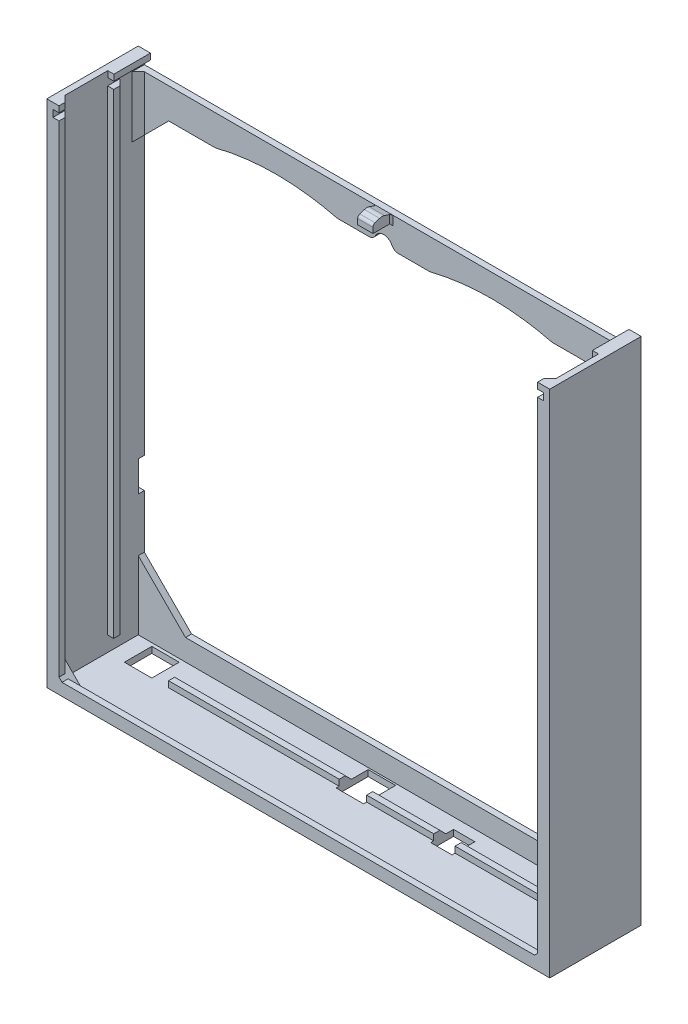
from build123d import *

# Parameters (mm, degrees)
BOSS_EXTRUDE1_DEPTH       = 35.56
BOSS_EXTRUDE2_DEPTH       = 2.54
BOSS_EXTRUDE3_REACH       = 236.724
BOSS_EXTRUDE4_REACH       = 236.724
BOSS_EXTRUDE5_DEPTH       = 2.54
BOSS_EXTRUDE6_DEPTH       = 204.47
BOSS_EXTRUDE7_REACH       = 236.724
BOSS_EXTRUDE8_DEPTH       = 2.54
BOSS_EXTRUDE9_DEPTH       = 2.54
SKETCH11_R                = 3.81
CUT_EXTRUDE1_DEPTH        = 2.54
FILLET1_R                 = 3.175
CHAMFER1_SIZE             = 2.54
SKETCH12_W                = 2.54
SKETCH12_H                = 38.1
BOSS_EXTRUDE10_DEPTH      = 5.461
SKETCH13_W                = 2.54
SKETCH13_H                = 2.54
BOSS_EXTRUDE11_DEPTH      = 38.1
BOSS_EXTRUDE12_DEPTH      = 3.175
BOSS_EXTRUDE12_DEPTH_BACK = 3.175
FILLET2_R                 = 3.175
CHAMFER2_SIZE             = 0.635
FILLET3_R                 = 1.27
CUT_EXTRUDE2_DEPTH        = 46.99
CUT_EXTRUDE2_DEPTH_BACK   = 3.175
SKETCH15_W                = 11.43
SKETCH15_H                = 11.43
SKETCH16_W                = 11.43
SKETCH16_H                = 37.106454998
SKETCH16_W_2              = 25.4
SKETCH16_H_2              = 12.337621438
CUT_EXTRUDE3_DEPTH        = 6.35
CUT_EXTRUDE4_DEPTH        = 2.54
SKETCH18_W                = 2.54
SKETCH18_H                = 12.7
CUT_EXTRUDE5_DEPTH        = 25.4
BOSS_EXTRUDE13_DEPTH      = 2.54
SKETCH20_W                = 8.89
SKETCH20_H                = 10.16
CUT_EXTRUDE6_DEPTH        = 2.54
SKETCH21_W                = 8.89
SKETCH21_H                = 9.525
CUT_EXTRUDE7_DEPTH        = 7.62


with BuildPart() as part:
    # Sketch1 → Boss-Extrude1 (new body)
    with BuildSketch(Plane.XY):
        Polygon((-102.235, 102.235), (-104.775, 102.235), (-104.775, -104.775), (104.775, -104.775), (104.775, 102.235), (102.235, 102.235), (102.235, -102.235), (-102.235, -102.235), align=None)
    extrude(amount=BOSS_EXTRUDE1_DEPTH)

    # Sketch2 → Boss-Extrude2 (add)
    with BuildSketch(Plane.XY.offset(35.56)):
        Polygon((-102.235, -102.235), (-102.235, -95.885), (-95.885, -102.235), align=None)
        Polygon((102.235, -102.235), (102.235, -95.885), (95.885, -102.235), align=None)
    extrude(amount=-BOSS_EXTRUDE2_DEPTH)

    # Boss-Extrude3: up to this face of the body (flat: up to its plane)
    boss_extrude3_end = Plane(part.part.faces().sort_by_distance((0, -102.235, 17.706426025))[0])
    # Sketch4 → Boss-Extrude3 (add, up to the picked face)
    with BuildSketch(Plane(origin=(0, 102.235, 0), x_dir=(1, 0, 0), z_dir=(0, 1, 0)), mode=Mode.PRIVATE) as boss_extrude3_sk1:
        Polygon((-102.235, -33.02), (-99.695, -35.56), (-102.235, -35.56), align=None)
    boss_extrude3_tool1 = split(extrude(boss_extrude3_sk1.sketch, amount=-BOSS_EXTRUDE3_REACH, mode=Mode.PRIVATE), bisect_by=boss_extrude3_end, keep=Keep.BOTH, mode=Mode.PRIVATE)
    # Sketch4 → Boss-Extrude3 (add, up to the picked face)
    with BuildSketch(Plane(origin=(0, 102.235, 0), x_dir=(1, 0, 0), z_dir=(0, 1, 0)), mode=Mode.PRIVATE) as boss_extrude3_sk2:
        Polygon((102.235, -33.02), (99.695, -35.56), (102.235, -35.56), align=None)
    boss_extrude3_tool2 = split(extrude(boss_extrude3_sk2.sketch, amount=-BOSS_EXTRUDE3_REACH, mode=Mode.PRIVATE), bisect_by=boss_extrude3_end, keep=Keep.BOTH, mode=Mode.PRIVATE)
    add(boss_extrude3_tool1.solids().sort_by(Axis((-101.388333, 102.235, 34.713333), (0, -1, 0)))[0])
    add(boss_extrude3_tool2.solids().sort_by(Axis((101.388333, 102.235, 34.713333), (0, -1, 0)))[0])

    # Boss-Extrude4: up to this plane
    boss_extrude4_end = Plane(origin=(102.235, -95.885, 33.02), z_dir=(-0.7071067811865476, 0.7071067811865476, 0))
    # Sketch5 → Boss-Extrude4 (add, up to the surface)
    with BuildSketch(Plane(origin=(-102.235, 0, 0), x_dir=(0, 0, -1), z_dir=(1, 0, 0)), mode=Mode.PRIVATE) as boss_extrude4_sk1:
        Polygon((-33.02, -102.235), (-35.56, -102.235), (-35.56, -99.695), align=None)
    boss_extrude4_tool1 = split(extrude(boss_extrude4_sk1.sketch, amount=BOSS_EXTRUDE4_REACH, mode=Mode.PRIVATE), bisect_by=boss_extrude4_end, keep=Keep.BOTH, mode=Mode.PRIVATE)
    add(boss_extrude4_tool1.solids().sort_by_distance((-102.235, -101.388333, 34.713333))[0])

    # Sketch6 → Boss-Extrude5 (add)
    with BuildSketch(Plane(origin=(0, -102.235, 0), x_dir=(1, 0, 0), z_dir=(0, 1, 0))):
        Polygon((0, -15.3162), (-102.235, -15.3162), (-102.235, -12.7762), (102.235, -12.7762), (102.235, -15.3162), align=None)
    extrude(amount=BOSS_EXTRUDE5_DEPTH)

    # Sketch7 → Boss-Extrude6 (add)
    with BuildSketch(Plane(origin=(-102.235, 0, 0), x_dir=(0, 0, -1), z_dir=(1, 0, 0))):
        Polygon((-12.7762, -99.695), (-10.2362, -102.235), (-12.7762, -102.235), align=None)
    extrude(amount=BOSS_EXTRUDE6_DEPTH)

    # Boss-Extrude7: up to this face of the body (flat: up to its plane)
    boss_extrude7_end = Plane(part.part.faces().sort_by_distance((0, -102.235, 24.1681))[0])
    # Sketch8 → Boss-Extrude7 (add, up to the picked face)
    with BuildSketch(Plane(origin=(0, 102.235, 0), x_dir=(1, 0, 0), z_dir=(0, 1, 0)), mode=Mode.PRIVATE) as boss_extrude7_sk1:
        Polygon((-102.235, -15.3162), (-99.695, -15.3162), (-99.695, -12.7762), (-102.235, -10.2362), align=None)
    boss_extrude7_tool1 = split(extrude(boss_extrude7_sk1.sketch, amount=-BOSS_EXTRUDE7_REACH, mode=Mode.PRIVATE), bisect_by=boss_extrude7_end, keep=Keep.BOTH, mode=Mode.PRIVATE)
    # Sketch8 → Boss-Extrude7 (add, up to the picked face)
    with BuildSketch(Plane(origin=(0, 102.235, 0), x_dir=(1, 0, 0), z_dir=(0, 1, 0)), mode=Mode.PRIVATE) as boss_extrude7_sk2:
        Polygon((99.695, -15.3162), (99.695, -12.7762), (102.235, -10.2362), (102.235, -15.3162), align=None)
    boss_extrude7_tool2 = split(extrude(boss_extrude7_sk2.sketch, amount=-BOSS_EXTRUDE7_REACH, mode=Mode.PRIVATE), bisect_by=boss_extrude7_end, keep=Keep.BOTH, mode=Mode.PRIVATE)
    add(boss_extrude7_tool1.solids().sort_by(Axis((-101.106111, 102.235, 13.340644), (0, -1, 0)))[0])
    add(boss_extrude7_tool2.solids().sort_by(Axis((101.106111, 102.235, 13.340644), (0, -1, 0)))[0])

    # Sketch9 → Boss-Extrude8 (add)
    with BuildSketch(Plane.XY.offset(35.56)):
        Polygon((-104.775, 102.235), (-99.695, 102.235), (-99.695, -98.425), (-98.425, -99.695), (98.425, -99.695), (99.695, -98.425), (99.695, 102.235), (104.775, 102.235), (104.775, -104.775), (-104.775, -104.775), align=None)
    extrude(amount=BOSS_EXTRUDE8_DEPTH)

    # Sketch10 → Boss-Extrude9 (add)
    with BuildSketch(Plane(origin=(0, 0, 0), x_dir=(-1, 0, 0), z_dir=(0, 0, -1))):
        Polygon((-102.235, 102.235), (102.235, 102.235), (102.235, 89.535), (102.235, 76.835), (89.535, 89.535), (-89.535, 89.535), (-102.235, 76.835), (-102.235, 89.535), align=None)
        Polygon((-102.235, -102.235), (-73.66, -102.235), (-102.235, -73.66), align=None)
        Polygon((102.235, -102.235), (73.66, -102.235), (102.235, -73.66), align=None)
    extrude(amount=-BOSS_EXTRUDE9_DEPTH)

    # Sketch11 → Cut-Extrude1 (cut)
    with BuildSketch(Plane(origin=(0, 0, 0), x_dir=(-1, 0, 0), z_dir=(0, 0, -1))):
        with Locations((0, 89.535)):
            Circle(SKETCH11_R)
        with BuildLine():
            Line((-44.7675, 89.535), (-19.3675, 89.535))
            add(Edge.make_bspline(
                [(-19.3675, 89.535), (-44.7675, 95.885), (-70.1675, 89.535)],
                knots=[0, 0, 0, 1, 1, 1], degree=2))
            Line((-70.1675, 89.535), (-44.7675, 89.535))
        make_face()
        with BuildLine():
            Line((44.7675, 89.535), (19.3675, 89.535))
            add(Edge.make_bspline(
                [(19.3675, 89.535), (44.7675, 95.885), (70.1675, 89.535)],
                knots=[0, 0, 0, 1, 1, 1], degree=2))
            Line((70.1675, 89.535), (44.7675, 89.535))
        make_face()
    extrude(amount=-CUT_EXTRUDE1_DEPTH, mode=Mode.SUBTRACT)

    # Fillet1
    fillet1_edges = [part.edges().sort_by_distance(p)[0] for p in [
        (-19.3675, 89.535, 1.27),
        (-70.1675, 89.535, 1.27),
        (70.1675, 89.535, 1.27),
        (19.3675, 89.535, 1.27),
        (-3.81, 89.535, 1.27),
        (3.81, 89.535, 1.27),
    ]]
    fillet(fillet1_edges, radius=FILLET1_R)

    # Chamfer1
    chamfer1_edges = [part.edges().sort_by_distance(p)[0] for p in [
        (-102.235, 89.535, 2.54),
        (102.235, 89.535, 2.54),
    ]]
    chamfer(chamfer1_edges, length=CHAMFER1_SIZE)

    # Sketch12 → Boss-Extrude10 (add)
    with BuildSketch(Plane(origin=(0, 102.235, 0), x_dir=(1, 0, 0), z_dir=(0, 1, 0))):
        with Locations((-103.505, -19.05)):
            Rectangle(SKETCH12_W, SKETCH12_H)
        with Locations((103.505, -19.05)):
            Rectangle(SKETCH12_W, SKETCH12_H)
    extrude(amount=BOSS_EXTRUDE10_DEPTH)

    # Sketch13 → Boss-Extrude11 (add)
    with BuildSketch(Plane.XY.offset(38.1)):
        with Locations((-100.965, 106.426)):
            Rectangle(SKETCH13_W, SKETCH13_H)
        with Locations((100.965, 106.426)):
            Rectangle(SKETCH13_W, SKETCH13_H)
    extrude(amount=-BOSS_EXTRUDE11_DEPTH)

    # Sketch14 → Boss-Extrude12 (add, two sides: drawn at the far end of the back side and taken through both)
    with BuildSketch(Plane(origin=(0, 0, 0), x_dir=(0, 0, -1), z_dir=(1, 0, 0)).offset(-BOSS_EXTRUDE12_DEPTH_BACK)):
        Polygon((-10.16, 99.06), (-2.54, 99.06), (-2.54, 102.235), (-6.35, 103.505), (-10.16, 102.235), align=None)
    extrude(amount=BOSS_EXTRUDE12_DEPTH + BOSS_EXTRUDE12_DEPTH_BACK)

    # Fillet2
    fillet2_edges = [part.edges().sort_by_distance(p)[0] for p in [
        (0, 103.505, 6.35),
    ]]
    fillet(fillet2_edges, radius=FILLET2_R)

    # Chamfer2
    # the kernel refuses this chamfer: 0.635 mm, written as the material it adds along each edge
    with BuildSketch(Plane(origin=(-3.175, 99.06, 2.54), x_dir=(0.02749587661058659, 0, 0.9996219169112968), z_dir=(0, 1, 0))) as chamfer2_piece_1_section:
        Polygon((CHAMFER2_SIZE * 0.999621916911, -CHAMFER2_SIZE * 0.0274958766106), (-CHAMFER2_SIZE * 0.0274958766106, -CHAMFER2_SIZE * 0.999621916911), (0, 0), align=None)
    chamfer2_piece_1 = extrude(amount=3.175, mode=Mode.PRIVATE)
    chamfer2_piece_1 = split(chamfer2_piece_1, bisect_by=Plane(origin=(-3.38440866, 102.139071745, 2.252215234), z_dir=(0, -0.9486832980505152, 0.3162277660168339)), keep=Keep.TOP, mode=Mode.PRIVATE)
    add(chamfer2_piece_1)
    with BuildSketch(Plane(origin=(-3.175, 99.06, 2.54), x_dir=(0.02749587661058659, 0, 0.9996219169112968), z_dir=(0, 1, 0))) as chamfer2_piece_2_section:
        Polygon((CHAMFER2_SIZE * 0.999621916911, -CHAMFER2_SIZE * 0.0274958766106), (-CHAMFER2_SIZE * 0.0274958766106, -CHAMFER2_SIZE * 0.999621916911), (0, 0), align=None)
    chamfer2_piece_2 = extrude(amount=4.808018697, mode=Mode.PRIVATE)
    chamfer2_piece_2 = split(chamfer2_piece_2, bisect_by=Plane(origin=(-3.319647303, 102.339821678, 2.854465035), z_dir=(0, -0.9486832980505152, 0.3162277660168339)), keep=Keep.TOP, mode=Mode.PRIVATE)
    chamfer2_piece_2 = split(chamfer2_piece_2, bisect_by=Plane(origin=(-3.319647303, 102.235, 2.871015826), z_dir=(0, 1, 0)), keep=Keep.TOP, mode=Mode.PRIVATE)
    add(chamfer2_piece_2)
    with BuildSketch(Plane(origin=(-3.175, 99.06, 2.54), x_dir=(0, -0.9996219169112966, -0.027495876610586965), z_dir=(1, 0, 0))) as chamfer2_piece_3:
        Polygon((CHAMFER2_SIZE * 0.999621916911, -CHAMFER2_SIZE * 0.0274958766106), (-CHAMFER2_SIZE * 0.0274958766106, -CHAMFER2_SIZE * 0.999621916911), (0, 0), align=None)
    extrude(amount=6.35)
    with BuildSketch(Plane(origin=(3.175, 99.06, 2.54), x_dir=(0.9996219169112968, 0, -0.027495876610587288), z_dir=(0, 1, 0))) as chamfer2_piece_4_section:
        Polygon((CHAMFER2_SIZE * 0.999621916911, -CHAMFER2_SIZE * 0.0274958766106), (-CHAMFER2_SIZE * 0.0274958766106, -CHAMFER2_SIZE * 0.999621916911), (0, 0), align=None)
    chamfer2_piece_4 = extrude(amount=3.175, mode=Mode.PRIVATE)
    chamfer2_piece_4 = split(chamfer2_piece_4, bisect_by=Plane(origin=(3.38440866, 102.139071745, 2.252215234), z_dir=(0, -0.9486832980505152, 0.3162277660168339)), keep=Keep.TOP, mode=Mode.PRIVATE)
    add(chamfer2_piece_4)
    with BuildSketch(Plane(origin=(3.175, 99.06, 2.54), x_dir=(0.9996219169112968, 0, -0.027495876610587288), z_dir=(0, 1, 0))) as chamfer2_piece_5_section:
        Polygon((CHAMFER2_SIZE * 0.999621916911, -CHAMFER2_SIZE * 0.0274958766106), (-CHAMFER2_SIZE * 0.0274958766106, -CHAMFER2_SIZE * 0.999621916911), (0, 0), align=None)
    chamfer2_piece_5 = extrude(amount=4.808018697, mode=Mode.PRIVATE)
    chamfer2_piece_5 = split(chamfer2_piece_5, bisect_by=Plane(origin=(3.319647303, 102.339821678, 2.854465035), z_dir=(0, -0.9486832980505152, 0.3162277660168339)), keep=Keep.TOP, mode=Mode.PRIVATE)
    chamfer2_piece_5 = split(chamfer2_piece_5, bisect_by=Plane(origin=(3.319647303, 102.235, 2.871015826), z_dir=(0, 1, 0)), keep=Keep.TOP, mode=Mode.PRIVATE)
    add(chamfer2_piece_5)
    with BuildSketch(Plane(origin=(-3.175, 97.426981303, 2.54), x_dir=(0.027495876610586608, 0, 0.9996219169112968), z_dir=(0, 1, 0))) as chamfer2_piece_6a_section:
        Polygon((CHAMFER2_SIZE * 0.999621916911, -CHAMFER2_SIZE * 0.0274958766106), (-CHAMFER2_SIZE * 0.0274958766106, -CHAMFER2_SIZE * 0.999621916911), (0, 0), align=None)
    chamfer2_piece_6a = extrude(amount=4.808018697, mode=Mode.PRIVATE)
    chamfer2_piece_6a = split(chamfer2_piece_6a, bisect_by=Plane(origin=(-3.384418953, 99.06, 2.749418953), z_dir=(0, -1, 0)), keep=Keep.TOP, mode=Mode.PRIVATE)
    with BuildSketch(Plane(origin=(-4.808018697, 99.06, 2.54), x_dir=(0, -0.9996219169112966, -0.027495876610585605), z_dir=(1, 0, 0))) as chamfer2_piece_6b_section:
        Polygon((CHAMFER2_SIZE * 0.999621916911, -CHAMFER2_SIZE * 0.0274958766106), (-CHAMFER2_SIZE * 0.0274958766106, -CHAMFER2_SIZE * 0.999621916911), (0, 0), align=None)
    chamfer2_piece_6b = extrude(amount=7.983018697, mode=Mode.PRIVATE)
    chamfer2_piece_6b = split(chamfer2_piece_6b, bisect_by=Plane(origin=(-3.175, 98.850581047, 2.749418953), z_dir=(-1, 0, 0)), keep=Keep.TOP, mode=Mode.PRIVATE)
    chamfer2_piece_6 = chamfer2_piece_6a & chamfer2_piece_6b
    add(chamfer2_piece_6)
    with BuildSketch(Plane(origin=(-3.175, 99.06, 2.54), x_dir=(0, -0.9996219169112966, -0.027495876610586965), z_dir=(1, 0, 0))) as chamfer2_piece_7a_section:
        Polygon((CHAMFER2_SIZE * 0.999621916911, -CHAMFER2_SIZE * 0.0274958766106), (-CHAMFER2_SIZE * 0.0274958766106, -CHAMFER2_SIZE * 0.999621916911), (0, 0), align=None)
    chamfer2_piece_7a = extrude(amount=7.983018697, mode=Mode.PRIVATE)
    chamfer2_piece_7a = split(chamfer2_piece_7a, bisect_by=Plane(origin=(3.175, 98.850581047, 2.749418953), z_dir=(1, 0, 0)), keep=Keep.TOP, mode=Mode.PRIVATE)
    with BuildSketch(Plane(origin=(3.175, 97.426981303, 2.54), x_dir=(0.9996219169112968, 0, -0.027495876610586608), z_dir=(0, 1, 0))) as chamfer2_piece_7b_section:
        Polygon((CHAMFER2_SIZE * 0.999621916911, -CHAMFER2_SIZE * 0.0274958766106), (-CHAMFER2_SIZE * 0.0274958766106, -CHAMFER2_SIZE * 0.999621916911), (0, 0), align=None)
    chamfer2_piece_7b = extrude(amount=4.808018697, mode=Mode.PRIVATE)
    chamfer2_piece_7b = split(chamfer2_piece_7b, bisect_by=Plane(origin=(3.384418953, 99.06, 2.749418953), z_dir=(0, -1, 0)), keep=Keep.TOP, mode=Mode.PRIVATE)
    chamfer2_piece_7 = chamfer2_piece_7a & chamfer2_piece_7b
    add(chamfer2_piece_7)

    # Fillet3
    fillet3_edges = [part.edges().sort_by_distance(p)[0] for p in [
        (0, 102.235, 10.16),
    ]]
    fillet(fillet3_edges, radius=FILLET3_R)

    # Sketch15 → Cut-Extrude2 (cut, two sides: drawn at the far end of the back side and taken through both)
    with BuildSketch(Plane(origin=(0, -102.235, 0), x_dir=(1, 0, 0), z_dir=(0, 1, 0)).offset(-CUT_EXTRUDE2_DEPTH_BACK)):
        with Locations((-89.535, -9.6012)):
            Rectangle(SKETCH15_W, SKETCH15_H)
        Polygon((-5.715, -10.2362), (-5.715, -15.3162), (-5.715, -16.5862), (5.715, -16.5862), (5.715, -15.3162), (5.715, -10.2362), (5.715, -3.2512), (-5.715, -3.2512), align=None)
    extrude(amount=CUT_EXTRUDE2_DEPTH + CUT_EXTRUDE2_DEPTH_BACK, mode=Mode.SUBTRACT)

    # Sketch16 → Cut-Extrude3 (cut)
    with BuildSketch(Plane(origin=(0, -102.235, 0), x_dir=(1, 0, 0), z_dir=(0, 1, 0))):
        with Locations((0, -8.636)):
            Rectangle(SKETCH16_W, SKETCH16_H)
        with Locations((-89.535, -9.6012)):
            Rectangle(SKETCH16_W_2, SKETCH16_H_2)
    extrude(amount=CUT_EXTRUDE3_DEPTH, mode=Mode.SUBTRACT)

    # Sketch17 → Cut-Extrude4 (cut)
    with BuildSketch(Plane(origin=(0, 107.696, 0), x_dir=(1, 0, 0), z_dir=(0, 1, 0))):
        Polygon((-102.235, -33.02), (-99.695, -35.56), (-99.695, -15.24), (-102.235, -15.24), align=None)
        Polygon((99.695, -15.24), (102.235, -15.24), (102.235, -33.02), (99.695, -35.56), align=None)
    extrude(amount=-CUT_EXTRUDE4_DEPTH, mode=Mode.SUBTRACT)

    # Sketch18 → Cut-Extrude5 (cut)
    with BuildSketch(Plane(origin=(-102.235, 0, 0), x_dir=(0, 0, -1), z_dir=(1, 0, 0))):
        with Locations((-1.27, -45.085)):
            Rectangle(SKETCH18_W, SKETCH18_H)
    extrude(amount=-CUT_EXTRUDE5_DEPTH, mode=Mode.SUBTRACT)

    # Sketch19 → Boss-Extrude13 (add)
    with BuildSketch(Plane.XY.offset(2.54)):
        Polygon((82.55, -93.345), (-82.55, -93.345), (-73.66, -102.235), (73.66, -102.235), align=None)
    extrude(amount=-BOSS_EXTRUDE13_DEPTH)

    # Sketch20 → Cut-Extrude6 (cut)
    with BuildSketch(Plane(origin=(0, -102.235, 0), x_dir=(1, 0, 0), z_dir=(0, 1, 0))):
        with Locations((38.1, -15.3162)):
            Rectangle(SKETCH20_W, SKETCH20_H)
    extrude(amount=CUT_EXTRUDE6_DEPTH, mode=Mode.SUBTRACT)

    # Sketch21 → Cut-Extrude7 (cut)
    with BuildSketch(Plane(origin=(0, -102.235, 0), x_dir=(1, 0, 0), z_dir=(0, 1, 0))):
        with Locations((38.1, -11.8237)):
            Rectangle(SKETCH21_W, SKETCH21_H)
    extrude(amount=-CUT_EXTRUDE7_DEPTH, mode=Mode.SUBTRACT)


solid = part.part
